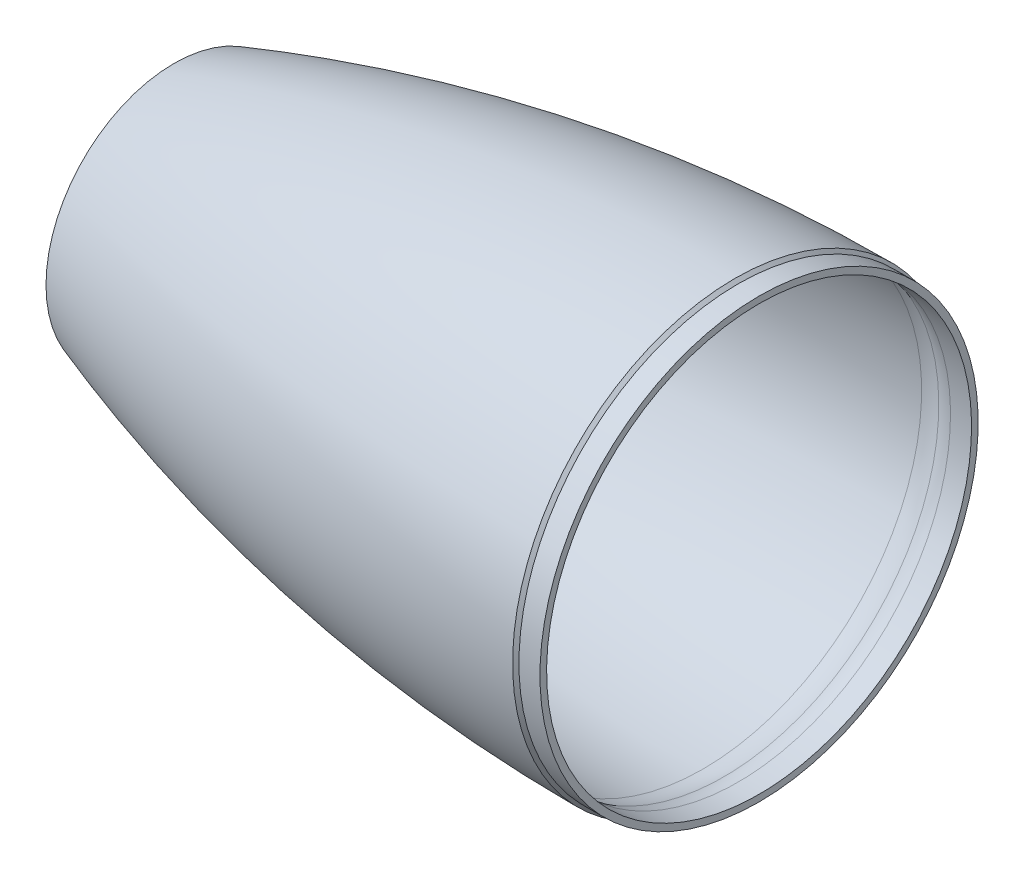
from build123d import *


with BuildPart() as part:
    # Sketch1 → Revolve1 (revolve)
    with BuildSketch(Plane.XY):
        with BuildLine():
            Line((-203.2, 46.355), (-203.2, 41.4909))
            Line((-203.2, 41.4909), (-197.891210988, 41.4909))
            ThreePointArc((-197.891210988, 41.4909), (-195.719383077, 41.873851858), (-193.809509666, 42.976517786))
            Line((-193.809509666, 42.976517786), (-184.628674394, 50.680153277))
            ThreePointArc((-184.628674394, 50.680153277), (-183.582047846, 51.393478578), (-182.414668632, 51.884890711))
            ThreePointArc((-182.414668632, 51.884890711), (-97.943461799, 71.535358737), (-11.557, 79.210311199))
            ThreePointArc((-11.557, 79.210311199), (-7.739510449, 78.92004648), (-4.044584679, 77.917547785))
            ThreePointArc((-4.044584679, 77.917547785), (-1.493258292, 77.212550225), (1.143, 76.975))
            Line((1.143, 76.975), (8.763, 76.975))
            Line((8.763, 76.975), (8.763, 79.375))
            Line((8.763, 79.375), (1.143, 79.375))
            Line((1.143, 79.375), (0, 80.518))
            ThreePointArc((0, 80.518), (-103.025907626, 71.917734953), (-203.2, 46.355))
        make_face()
    revolve(axis=Axis((0, 0, 0), (-1, 0, 0)))


solid = part.part
